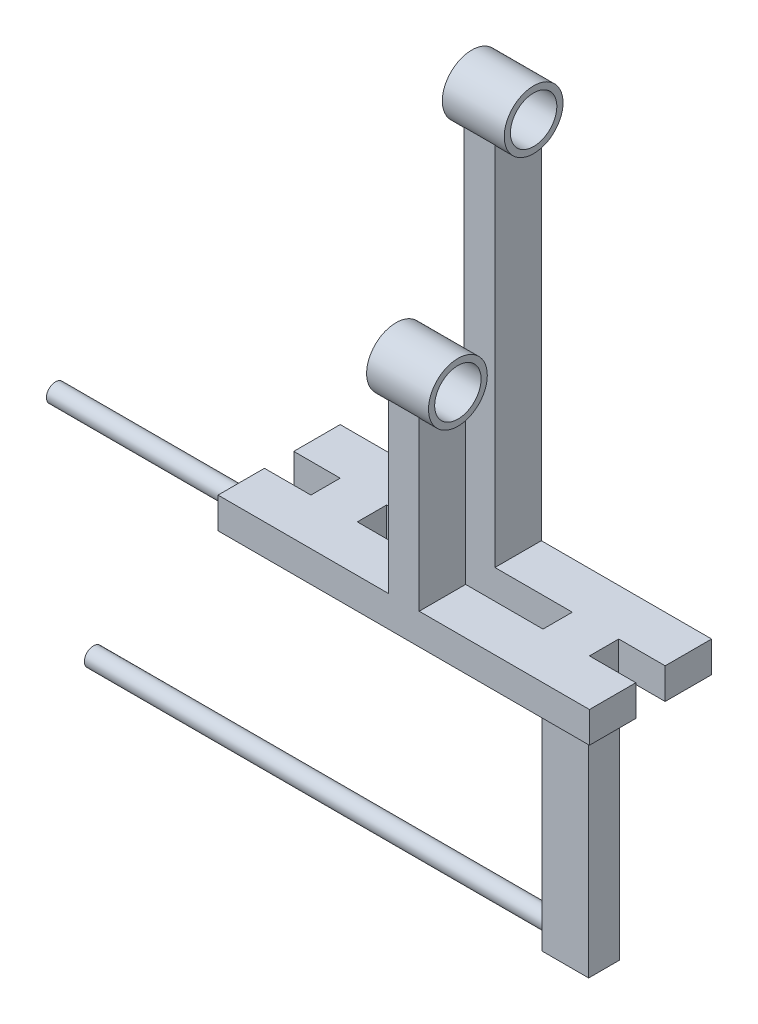
from build123d import *

# Parameters (mm, degrees)
SKETCH2_W               = 60
SKETCH2_H               = 9.4666089
BOSS_EXTRUDE2_DEPTH     = 10
SKETCH3_W               = 10
SKETCH3_H               = 15
BOSS_EXTRUDE3_DEPTH     = 60
SKETCH4_W               = 10
SKETCH4_H               = 15
BOSS_EXTRUDE4_DEPTH     = 64.0502592
SKETCH6_R               = 9.5
SKETCH6_R_2             = 7.5
EXTRUDE_THIN1_DEPTH     = 10
CUT_EXTRUDE1_DEPTH      = 160.787854054
CUT_EXTRUDE1_DEPTH_BACK = 160.787854054
SKETCH8_W               = 15
SKETCH8_H               = 10
BOSS_EXTRUDE5_DEPTH     = 80
SKETCH9_R               = 2.95
BOSS_EXTRUDE6_DEPTH     = 150
SKETCH10_R              = 2.95
BOSS_EXTRUDE7_DEPTH     = 60


with BuildPart() as part:
    # Sketch2 → Boss-Extrude2 (new body)
    with BuildSketch(Plane(origin=(0, 0, 0), x_dir=(1, 0, 0), z_dir=(0, 1, 0))):
        Polygon((60, -15), (-60, -15), (-60, 0), (-45, 0), (-45, 9.4666089), (-60, 9.4666089), (-60, 24.4666089), (60, 24.4666089), (60, 9.4666089), (45, 9.4666089), (45, 0), (60, 0), align=None)
        with Locations((0, 4.73330445)):
            Rectangle(SKETCH2_W, SKETCH2_H, mode=Mode.SUBTRACT)
    extrude(amount=BOSS_EXTRUDE2_DEPTH)

    # Sketch3 → Boss-Extrude3 (add)
    with BuildSketch(Plane(origin=(0, 10, 0), x_dir=(1, 0, 0), z_dir=(0, 1, 0))):
        with Locations((0, -7.5)):
            Rectangle(SKETCH3_W, SKETCH3_H)
        with Locations((0, 16.9666089)):
            Rectangle(SKETCH3_W, SKETCH3_H)
    extrude(amount=BOSS_EXTRUDE3_DEPTH)

    # Sketch4 → Boss-Extrude4 (add)
    with BuildSketch(Plane(origin=(0, 70, 0), x_dir=(1, 0, 0), z_dir=(0, 1, 0))):
        with Locations((0, 16.9666089)):
            Rectangle(SKETCH4_W, SKETCH4_H)
    extrude(amount=BOSS_EXTRUDE4_DEPTH)

    # Sketch6 → Extrude-Thin1 (add, symmetric)
    # profile 1 of 2: a face of its own
    with BuildSketch(Plane(origin=(0, 0, 0), x_dir=(0, 0, -1), z_dir=(1, 0, 0))):
        with Locations((-7.5, 70)):
            Circle(SKETCH6_R)
        with Locations((-7.5, 70)):
            Circle(SKETCH6_R_2, mode=Mode.SUBTRACT)
    # profile 2 of 2: a face of its own
    with BuildSketch(Plane(origin=(0, 0, 0), x_dir=(0, 0, -1), z_dir=(1, 0, 0))):
        with Locations((16.9666089, 134.0502592)):
            Circle(SKETCH6_R)
        with Locations((16.9666089, 134.0502592)):
            Circle(SKETCH6_R_2, mode=Mode.SUBTRACT)
    extrude(amount=EXTRUDE_THIN1_DEPTH, both=True)

    # Sketch7 → Cut-Extrude1 (cut, two sides: drawn at the far end of the back side and taken through both)
    with BuildSketch(Plane(origin=(5, 0, 0), x_dir=(0, 0, -1), z_dir=(1, 0, 0)).offset(-CUT_EXTRUDE1_DEPTH_BACK)):
        with BuildLine():
            Line((0, 70), (-15, 70))
            ThreePointArc((-15, 70), (-7.5, 62.5), (0, 70))
        make_face()
        with BuildLine():
            Line((24.4666089, 134.0502592), (9.4666089, 134.0502592))
            ThreePointArc((9.4666089, 134.0502592), (16.9666089, 126.5502592), (24.4666089, 134.0502592))
        make_face()
    extrude(amount=CUT_EXTRUDE1_DEPTH + CUT_EXTRUDE1_DEPTH_BACK, mode=Mode.SUBTRACT)

    # Sketch8 → Boss-Extrude5 (add)
    with BuildSketch(Plane.XZ):
        with Locations((37.5, -4.75)):
            Rectangle(SKETCH8_W, SKETCH8_H)
    extrude(amount=BOSS_EXTRUDE5_DEPTH)

    # Sketch9 → Boss-Extrude6 (add)
    with BuildSketch(Plane.ZY.offset(-30)):
        with Locations((-4.75, -75)):
            Circle(SKETCH9_R)
    extrude(amount=BOSS_EXTRUDE6_DEPTH)

    # Sketch10 → Boss-Extrude7 (add)
    with BuildSketch(Plane.ZY.offset(60)):
        with Locations((7.5, 5)):
            Circle(SKETCH10_R)
    extrude(amount=BOSS_EXTRUDE7_DEPTH)


solid = part.part
